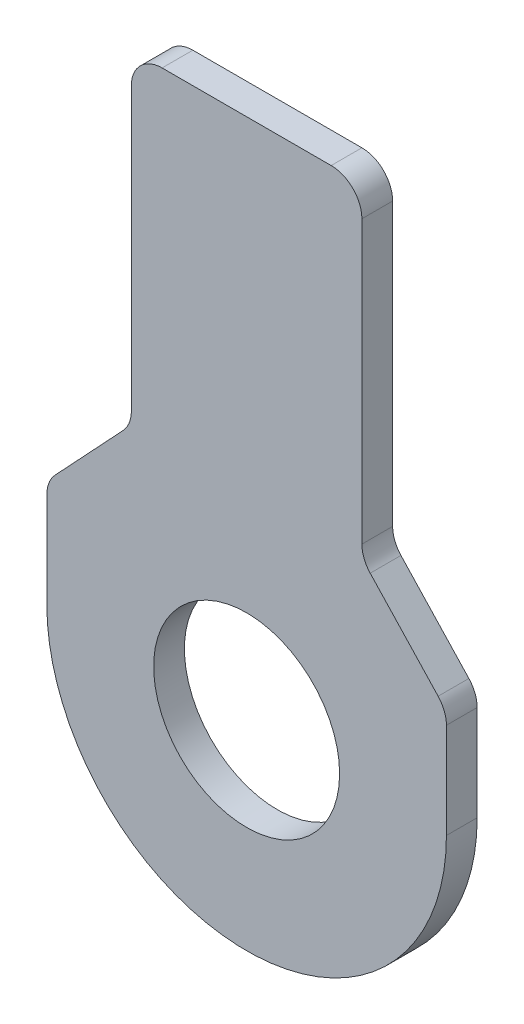
from build123d import *

# Parameters (mm, degrees)
SKETCH1_R          = 3.025
BASE_FLANGE1_DEPTH = 1


# Sheet-metal steps are written as plain solids
with BuildPart() as part:
    # Sketch1 → Base-Flange1 (new body)
    with BuildSketch(Plane.XY):
        with BuildLine():
            Line((6.5, 0), (6.5, 3.105048502))
            ThreePointArc((6.5, 3.105048502), (6.430087021, 3.472387764), (6.230123733, 3.788363462))
            Line((6.230123733, 3.788363462), (4.019876267, 6.150018373))
            ThreePointArc((4.019876267, 6.150018373), (3.819912979, 6.465994071), (3.75, 6.833333333))
            Line((3.75, 6.833333333), (3.75, 16))
            ThreePointArc((3.75, 16), (3.457106781, 16.707106781), (2.75, 17))
            Line((2.75, 17), (-2.75, 17))
            ThreePointArc((-2.75, 17), (-3.457106781, 16.707106781), (-3.75, 16))
            Line((-3.75, 16), (-3.75, 6.833333333))
            ThreePointArc((-3.75, 6.833333333), (-3.819912979, 6.465994071), (-4.019876267, 6.150018373))
            Line((-4.019876267, 6.150018373), (-6.230123733, 3.788363462))
            ThreePointArc((-6.230123733, 3.788363462), (-6.430087021, 3.472387764), (-6.5, 3.105048502))
            Line((-6.5, 3.105048502), (-6.5, 0))
            ThreePointArc((-6.5, 0), (0, -6.5), (6.5, 0))
        make_face()
        Circle(SKETCH1_R, mode=Mode.SUBTRACT)
    extrude(amount=-BASE_FLANGE1_DEPTH)


solid = part.part
